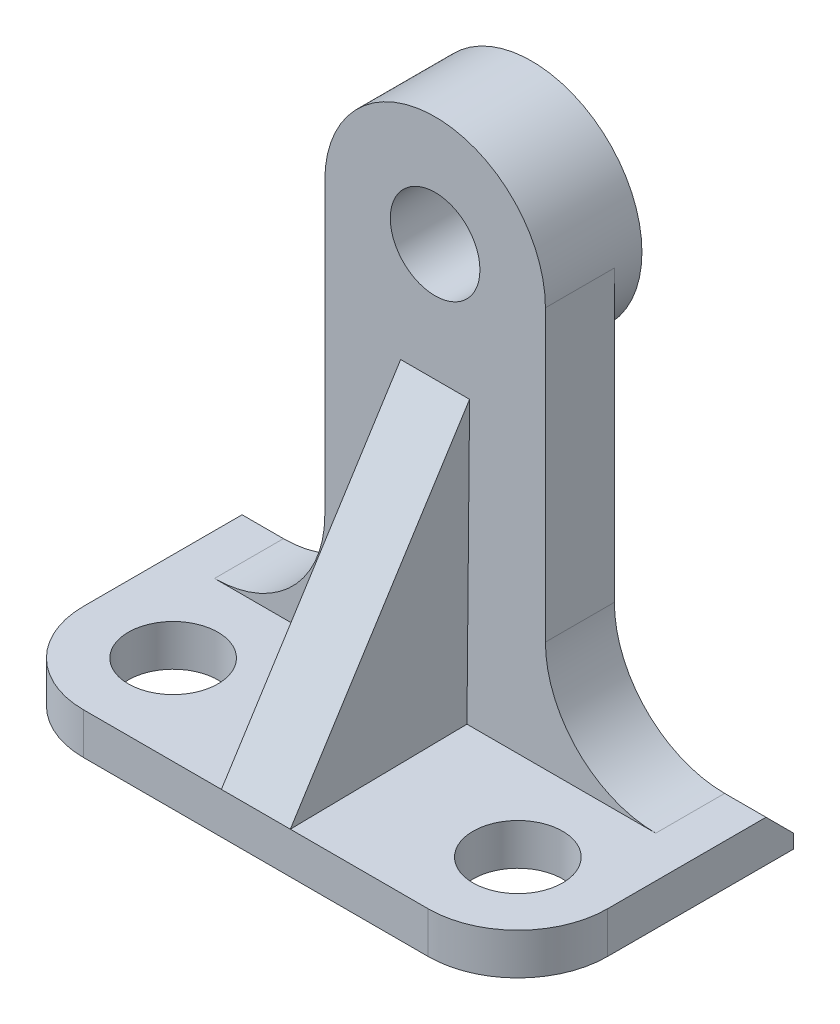
from build123d import *
from build123d.topology import SkipClean

# Parameters (mm, degrees)
CROQUIS1_R              = 6.5
SALIENTE_EXTRUIR1_DEPTH = 10
SALIENTE_EXTRUIR2_START = 4
CROQUIS2_R              = 16
SALIENTE_EXTRUIR2_DEPTH = 4
CROQUIS3_R              = 6.5
CORTAR_EXTRUIR1_DEPTH   = 4
SALIENTE_EXTRUIR3_DEPTH = 6
NERVIO1_REACH           = 84.68
CROQUIS5_WALL_W         = 215.909157244
CROQUIS5_WALL_H         = 10
NERVIO1_DRAFT_ANGLE     = -1
CHAFL_N3_SIZE           = 4
REDONDEO1_R             = 13
REDONDEO2_R             = 13
CROQUIS6_R              = 6.5
CORTAR_EXTRUIR2_DEPTH   = 6


with BuildPart() as part:
    # Croquis1 → Saliente-Extruir1 (new body)
    with BuildSketch(Plane.XY):
        with BuildLine():
            Line((-16, 0), (-16, -42))
            ThreePointArc((-16, -42), (-20.686291501, -53.313708499), (-32, -58))
            Line((-32, -58), (-38, -58))
            Line((-38, -58), (-38, -64))
            Line((-38, -64), (38, -64))
            Line((38, -64), (38, -58))
            Line((38, -58), (32, -58))
            ThreePointArc((32, -58), (20.686291501, -53.313708499), (16, -42))
            Line((16, -42), (16, 0))
            ThreePointArc((16, 0), (0, 16), (-16, 0))
        make_face()
        Circle(CROQUIS1_R, mode=Mode.SUBTRACT)
    extrude(amount=SALIENTE_EXTRUIR1_DEPTH)

    # Croquis2 → Saliente-Extruir2 (add)
    with SkipClean():  # the faces are left unmerged after this step: merging them gives an invalid solid
        with BuildSketch(Plane(origin=(0, 0, 0), x_dir=(-1, 0, 0), z_dir=(0, 0, -1)).offset(SALIENTE_EXTRUIR2_START)):
            Circle(CROQUIS2_R)
        extrude(amount=-SALIENTE_EXTRUIR2_DEPTH)

    # Croquis3 → Cortar-Extruir1 (cut)
    with SkipClean():  # the faces are left unmerged after this step: merging them gives an invalid solid
        with BuildSketch(Plane(origin=(0, 0, -4), x_dir=(-1, 0, 0), z_dir=(0, 0, -1))):
            Circle(CROQUIS3_R)
        extrude(amount=-CORTAR_EXTRUIR1_DEPTH, mode=Mode.SUBTRACT)

    # Croquis4 → Saliente-Extruir3 (add)
    with SkipClean():  # the faces are left unmerged after this step: merging them gives an invalid solid
        with BuildSketch(Plane.XZ.offset(64)):
            Polygon((38, 0), (38, 36), (-38, 36), (-38, -4), (38, -4), align=None)
        extrude(amount=-SALIENTE_EXTRUIR3_DEPTH)

    # Croquis5 wall → Nervio1 (add, up to next)
    with BuildSketch(Plane(origin=(0, -37.5, 23), x_dir=(0, 0.84450857845, -0.535542025358), z_dir=(0, 0.535542025358, 0.84450857845)), mode=Mode.PRIVATE) as nervio1_sk1:
        Rectangle(CROQUIS5_WALL_W, CROQUIS5_WALL_H)
    nervio1_tool1 = extrude(nervio1_sk1.sketch, amount=-NERVIO1_REACH, mode=Mode.PRIVATE) - part.part
    add(nervio1_tool1.solids().sort_by_distance((0, -37.5, 23))[0])

    # Nervio1 draft
    nervio1_draft_faces = [part.faces().sort_by_distance(p)[0] for p in [
        (-5, -37.767771013, 22.577745711),
        (5, -37.767771013, 22.577745711),
    ]]
    draft(nervio1_draft_faces, Plane(origin=(0, -37.5, 23), x_dir=(0, 0.84450857845, -0.535542025358), z_dir=(0, 0.535542025358, 0.84450857845)), NERVIO1_DRAFT_ANGLE)

    # Chaflán3
    chafl_n3_edges = [part.edges().sort_by_distance(p)[0] for p in [
        (0, -58, -4),
    ]]
    chamfer(chafl_n3_edges, length=CHAFL_N3_SIZE - 0.0001)  # a hair under: the kernel refuses the full size

    # Redondeo1
    redondeo1_edges = [part.edges().sort_by_distance(p)[0] for p in [
        (-38, -61, 36),
    ]]
    fillet(redondeo1_edges, radius=REDONDEO1_R)

    # Redondeo2
    redondeo2_edges = [part.edges().sort_by_distance(p)[0] for p in [
        (38, -61, 36),
    ]]
    fillet(redondeo2_edges, radius=REDONDEO2_R)

    # Croquis6 → Cortar-Extruir2 (cut)
    with BuildSketch(Plane(origin=(0, -58, 0), x_dir=(1, 0, 0), z_dir=(0, 1, 0))):
        with Locations(Location((-25, -23, 0), (0, 0, 270))):
            Circle(CROQUIS6_R)
        with Locations(Location((25, -23, 0), (0, 0, 270))):
            Circle(CROQUIS6_R)
    extrude(amount=-CORTAR_EXTRUIR2_DEPTH, mode=Mode.SUBTRACT)


solid = part.part
